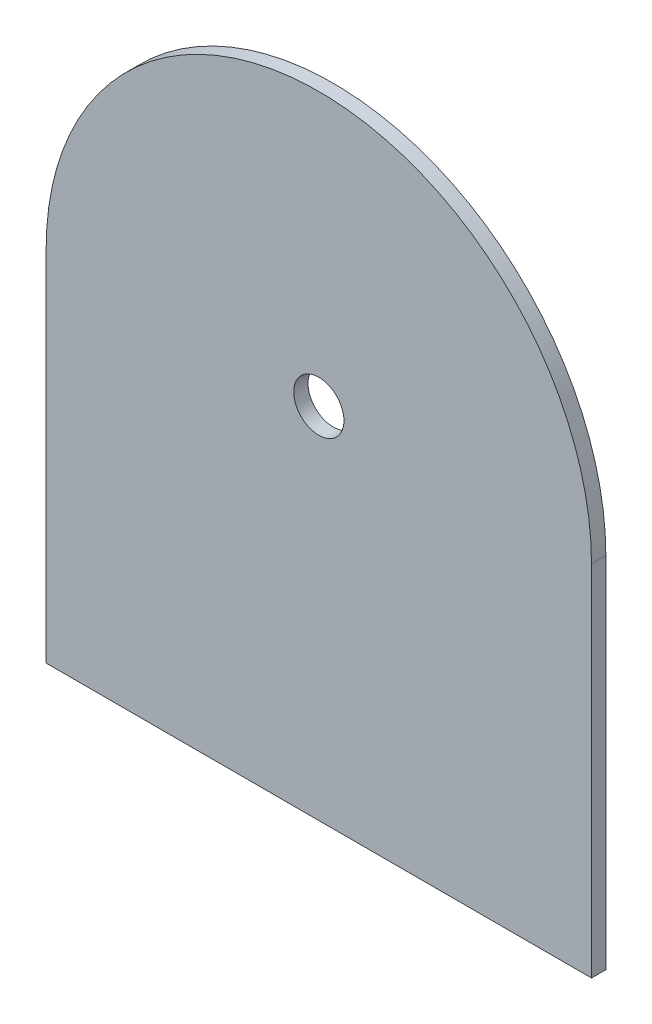
from build123d import *

# Parameters (mm, degrees)
OUTER_CASING_DEPTH = 5
SKETCH1_R          = 8.75
INNER_CUTOUT_DEPTH = 10


with BuildPart() as part:
    # Plate shape → Outer casing (new body)
    with BuildSketch(Plane.XY):
        with BuildLine():
            Line((-95, 0), (95, 0))
            Line((95, 0), (95, 125))
            ThreePointArc((95, 125), (0, 220), (-95, 125))
            Line((-95, 125), (-95, 0))
        make_face()
    extrude(amount=OUTER_CASING_DEPTH)

    # Sketch1 → Inner Cutout (cut)
    with BuildSketch(Plane.XY.offset(5)):
        with Locations((0, 125)):
            Circle(SKETCH1_R)
    extrude(amount=-INNER_CUTOUT_DEPTH, mode=Mode.SUBTRACT)


solid = part.part
